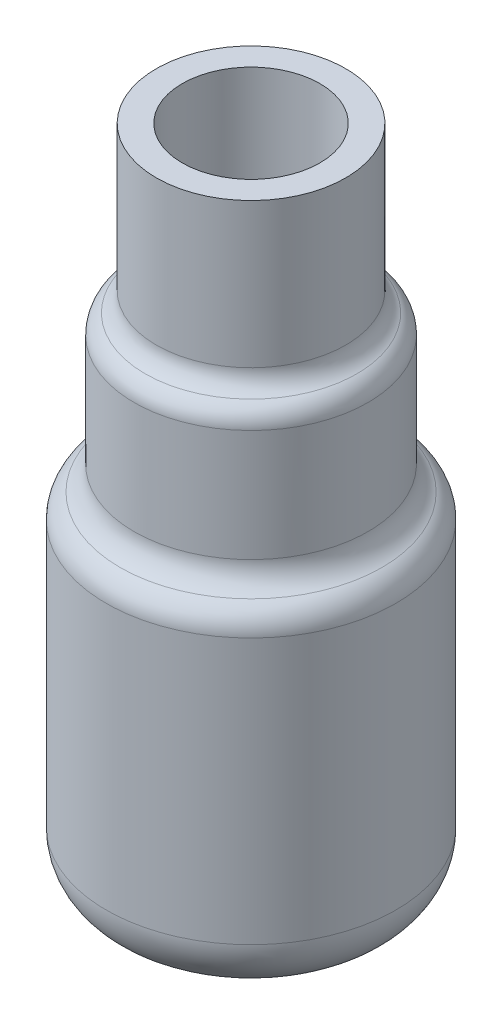
from build123d import *

# Parameters (mm, degrees)
SKETCH_1_R      = 26
SKETCH_1_R_2    = 21
EXTRUDE_1_DEPTH = 60
FILLET_1_R      = 10
EXTRUDE_START   = -2
SKETCH_2_R      = 21
SKETCH_2_R_2    = 12.35
EXTRUDE_2_DEPTH = 30
SKETCH_3_R      = 17
SKETCH_3_R_2    = 12.35
EXTRUDE_3_DEPTH = 30
FILLET_3_R      = 4
FILLET_4_R      = 4
FILLET_6_R      = 5
FILLET_7_R      = 5
FILLET_8_R      = 5
FILLET_9_R      = 5


# Some blends are built 0.0001 mm under size
with BuildPart() as part:
    # Эскиз1 → Вытянуть1 (new body)
    with BuildSketch(Plane(origin=(0, 0, 0), x_dir=(1, 0, 0), z_dir=(0, 1, 0))):
        with Locations(Location((0, 0, 0), (0, 0, 270))):
            Circle(SKETCH_1_R)
        with Locations(Location((0, 0, 0), (0, 0, 270))):
            Circle(SKETCH_1_R_2, mode=Mode.SUBTRACT)
    extrude(amount=EXTRUDE_1_DEPTH)

    # Скругление1
    # the kernel refuses this fillet: 10 mm, written as the material it takes off along each edge
    with BuildSketch(Plane(origin=(0, 0, 0), x_dir=(0, 0, 1), z_dir=(-1, 0, 0))) as fillet_1_piece_1:
        with BuildLine():
            CenterArc((16, 8.660254038), FILLET_1_R, 300, 60)
            Line((21, 0), (21.1, -0.173205081))
            ThreePointArc((21.1, -0.173205081), (23.5, -0.2), (26, -0.2))
            Line((26, -0.2), (26.2, 0))
            Line((26.2, 0), (26.2, 8.660254038))
            Line((26.2, 8.660254038), (26, 8.660254038))
        make_face()
    revolve(axis=Axis((0, 0, 0), (0, 1, 0)), mode=Mode.SUBTRACT)

    # Эскиз2 → Вытянуть2 (add)
    with BuildSketch(Plane(origin=(0, 60, 0), x_dir=(1, 0, 0), z_dir=(0, 1, 0)).offset(EXTRUDE_START)):
        with Locations(Location((0, 0, 0), (0, 0, 270))):
            Circle(SKETCH_2_R)
        with Locations(Location((0, 0, 0), (0, 0, 270))):
            Circle(SKETCH_2_R_2, mode=Mode.SUBTRACT)
    extrude(amount=EXTRUDE_2_DEPTH)

    # Эскиз3 → Вытянуть3 (add)
    with BuildSketch(Plane(origin=(0, 88, 0), x_dir=(1, 0, 0), z_dir=(0, 1, 0))):
        with Locations(Location((0, 0, 0), (0, 0, 270))):
            Circle(SKETCH_3_R)
        with Locations(Location((0, 0, 0), (0, 0, 270))):
            Circle(SKETCH_3_R_2, mode=Mode.SUBTRACT)
    extrude(amount=EXTRUDE_3_DEPTH)

    # Скругление3
    fillet_3_edges = [part.edges().sort_by_distance(p)[0] for p in [
        (0, 88, -17),
    ]]
    fillet(fillet_3_edges, radius=FILLET_3_R - 0.0001)  # a hair under: the kernel refuses the full size

    # Скругление4
    fillet_4_edges = [part.edges().sort_by_distance(p)[0] for p in [
        (0, 88, -21),
    ]]
    fillet(fillet_4_edges, radius=FILLET_4_R)

    # Скругление6
    fillet_6_edges = [part.edges().sort_by_distance(p)[0] for p in [
        (0, 60, -21),
    ]]
    fillet(fillet_6_edges, radius=FILLET_6_R - 0.0001)  # a hair under: the kernel refuses the full size

    # Скругление7
    fillet_7_edges = [part.edges().sort_by_distance(p)[0] for p in [
        (0, 60, -26),
    ]]
    fillet(fillet_7_edges, radius=FILLET_7_R)

    # Скругление8
    fillet_8_edges = [part.edges().sort_by_distance(p)[0] for p in [
        (0, 58, -21),
    ]]
    fillet(fillet_8_edges, radius=FILLET_8_R)

    # Скругление9
    fillet_9_edges = [part.edges().sort_by_distance(p)[0] for p in [
        (0, 58, -12.35),
    ]]
    fillet(fillet_9_edges, radius=FILLET_9_R)


solid = part.part
